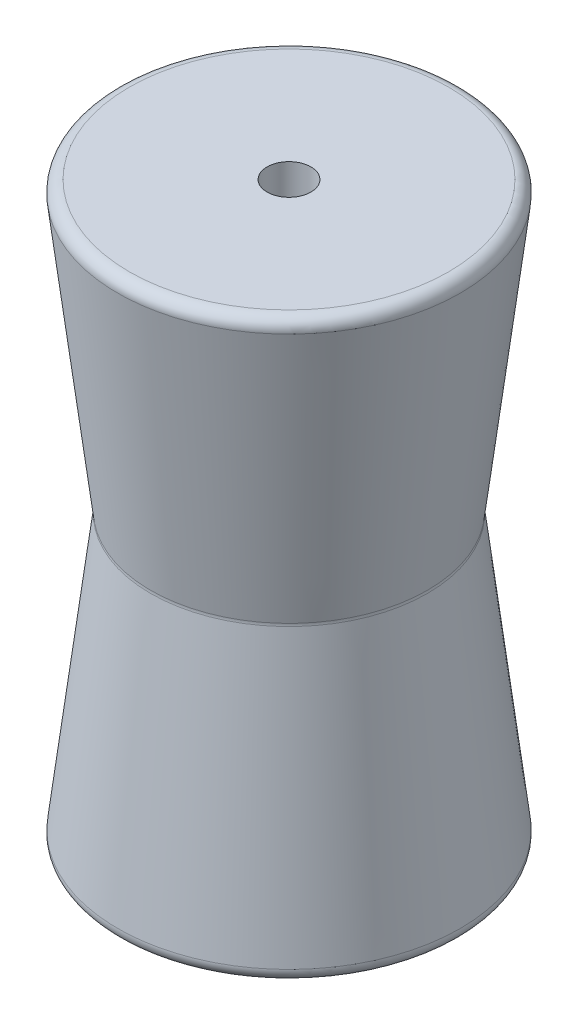
from build123d import *

# Parameters (mm, degrees)
SKETCH_3_R          = 1.9
CUT_EXTRUDE_1_DEPTH = 60
FILLET_1_R          = 1


with BuildPart() as part:
    # 草图2 → 旋转1 (revolve)
    with BuildSketch(Plane.XY):
        Polygon((-15, 0), (0, 0), (0, 50), (-15, 50), (-12, 25), align=None)
    revolve(axis=Axis((0, 0, 0), (0, 1, 0)))

    # 草图3 → 切除-拉伸1 (cut)
    with BuildSketch(Plane.XZ):
        Circle(SKETCH_3_R)
    extrude(amount=-CUT_EXTRUDE_1_DEPTH, mode=Mode.SUBTRACT)

    # 圆角1
    fillet_1_edges = [part.edges().sort_by_distance(p)[0] for p in [
        (15, 0, 0),
        (12, 25, 0),
        (15, 50, 0),
    ]]
    fillet(fillet_1_edges, radius=FILLET_1_R)


solid = part.part
